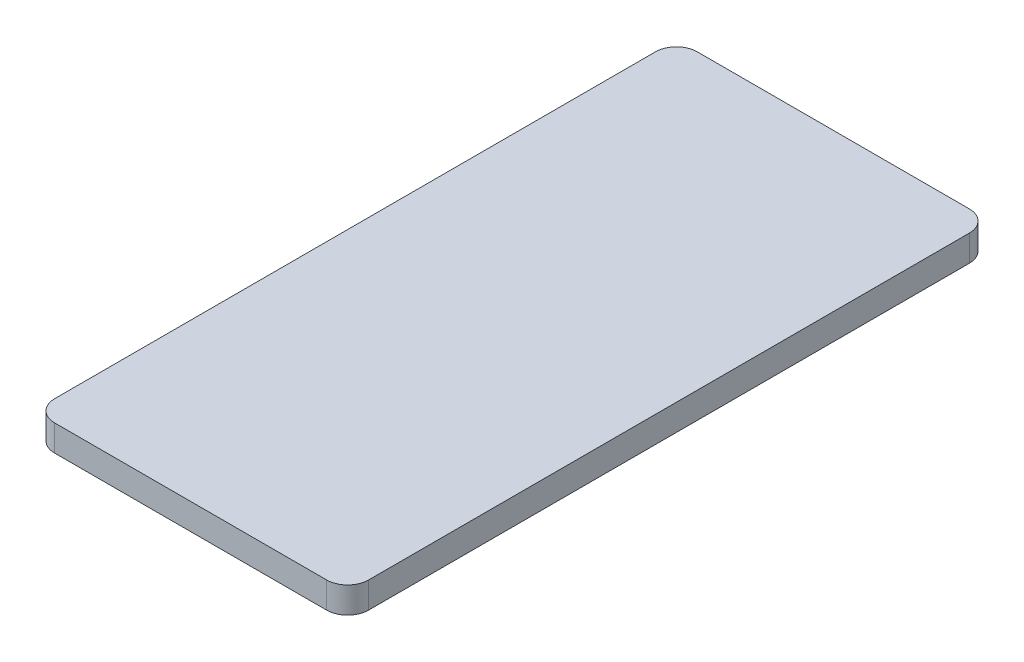
from build123d import *

# Parameters (mm, degrees)
SKETCH1_W           = 38.1
SKETCH1_H           = 78
BOSS_EXTRUDE1_DEPTH = 3.175
FILLET1_R           = 2.54


with BuildPart() as part:
    # Sketch1 → Boss-Extrude1 (new body)
    with BuildSketch(Plane(origin=(0, 0, 0), x_dir=(1, 0, 0), z_dir=(0, 1, 0))):
        with Locations((19.05, 39)):
            Rectangle(SKETCH1_W, SKETCH1_H)
    extrude(amount=BOSS_EXTRUDE1_DEPTH)

    # Fillet1
    fillet1_edges = [part.edges().sort_by_distance(p)[0] for p in [
        (38.1, 1.5875, 0),
        (0, 1.5875, 0),
        (38.1, 1.5875, -78),
        (0, 1.5875, -78),
    ]]
    fillet(fillet1_edges, radius=FILLET1_R)


solid = part.part
